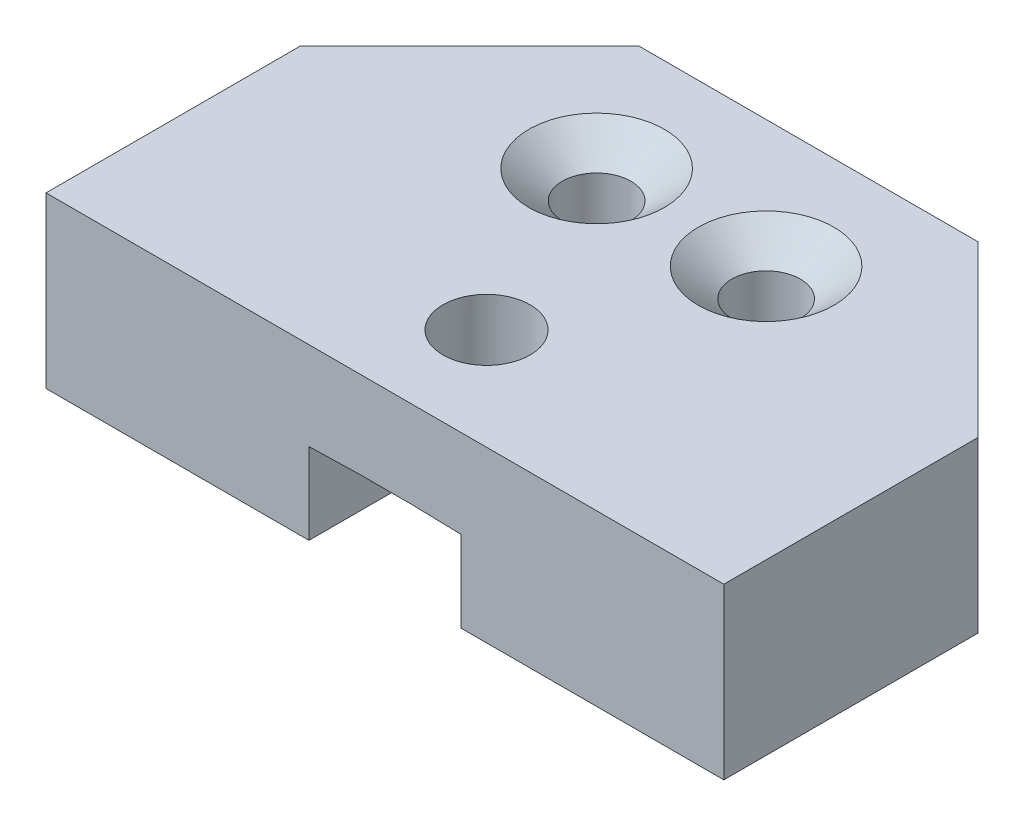
from build123d import *

# Parameters (mm, degrees)
SKETCH1_W                                          = 25.4
SKETCH1_H                                          = 15.875
BOSS_EXTRUDE1_DEPTH                                = 6.35
CHAMFER1_SIZE                                      = 6.35
CUT_EXTRUDE1_DEPTH                                 = 22.298547486
SKETCH3_R                                          = 1.63195
CUT_EXTRUDE2_DEPTH                                 = 17.267034341
CSK_FOR_10_FLAT_HEAD_MACHINE_SCREW_100_D           = 2.5654
CSK_FOR_10_FLAT_HEAD_MACHINE_SCREW_100_CSINK_D     = 5.08
CSK_FOR_10_FLAT_HEAD_MACHINE_SCREW_100_CSINK_ANGLE = 100


with BuildPart() as part:
    # Sketch1 → Boss-Extrude1 (new body)
    with BuildSketch(Plane(origin=(0, 0, 0), x_dir=(1, 0, 0), z_dir=(0, 1, 0))):
        Rectangle(SKETCH1_W, SKETCH1_H)
    extrude(amount=BOSS_EXTRUDE1_DEPTH)

    # Chamfer1
    chamfer1_edges = [part.edges().sort_by_distance(p)[0] for p in [
        (12.7, 3.175, -7.9375),
        (-12.7, 3.175, -7.9375),
    ]]
    chamfer(chamfer1_edges, length=CHAMFER1_SIZE)

    # Sketch2 → Cut-Extrude1 (cut, through all)
    with BuildSketch(Plane.XY.offset(7.9375)):
        with BuildLine():
            Line((-2.8448, 3.043361407), (-2.8448, 0))
            Line((-2.8448, 0), (2.8448, 0))
            Line((2.8448, 0), (2.8448, 3.043361407))
            ThreePointArc((2.8448, 3.043361407), (0, 3.096482857), (-2.8448, 3.043361407))
        make_face()
    extrude(amount=-CUT_EXTRUDE1_DEPTH, mode=Mode.SUBTRACT)

    # Sketch3 → Cut-Extrude2 (cut, through all)
    with BuildSketch(Plane(origin=(0, 6.35, 0), x_dir=(1, 0, 0), z_dir=(0, 1, 0))):
        with Locations((0, -4.129280278)):
            Circle(SKETCH3_R)
    extrude(amount=-CUT_EXTRUDE2_DEPTH, mode=Mode.SUBTRACT)

    # CSK for #10 Flat Head Machine Screw (100)1 (through all)
    with Locations(Plane(origin=(0, 6.35, 0), x_dir=(1, 0, 0), z_dir=(0, 1, 0))):
        with Locations((3.173219722, 3.173219722), (-3.176780278, 3.173219722)):
            CounterSinkHole(CSK_FOR_10_FLAT_HEAD_MACHINE_SCREW_100_D / 2, CSK_FOR_10_FLAT_HEAD_MACHINE_SCREW_100_CSINK_D / 2, counter_sink_angle=CSK_FOR_10_FLAT_HEAD_MACHINE_SCREW_100_CSINK_ANGLE)


solid = part.part
